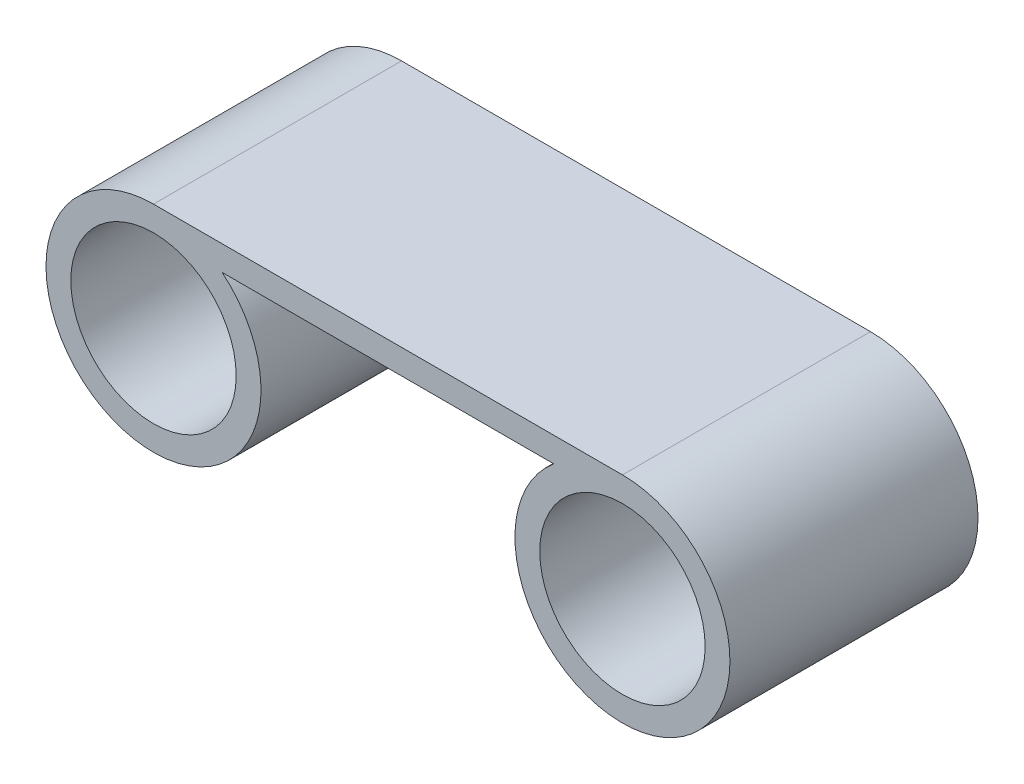
from build123d import *

# Parameters (mm, degrees)
SKETCH2_R           = 10
BOSS_EXTRUDE1_DEPTH = 30


with BuildPart() as part:
    # Sketch2 → Boss-Extrude1 (new body)
    with BuildSketch(Plane.XY):
        with BuildLine():
            Line((-28.356749492, 0), (28.356749492, 0))
            ThreePointArc((28.356749492, 0), (32.772629925, -25.227019261), (20.050125629, -3))
            Line((20.050125629, -3), (-20.050125629, -3))
            ThreePointArc((-20.050125629, -3), (-32.772629925, -25.227019261), (-28.356749492, 0))
        make_face()
        with Locations((-28.356749492, -13)):
            Circle(SKETCH2_R, mode=Mode.SUBTRACT)
        with Locations((28.356749492, -13)):
            Circle(SKETCH2_R, mode=Mode.SUBTRACT)
    extrude(amount=BOSS_EXTRUDE1_DEPTH)


solid = part.part
